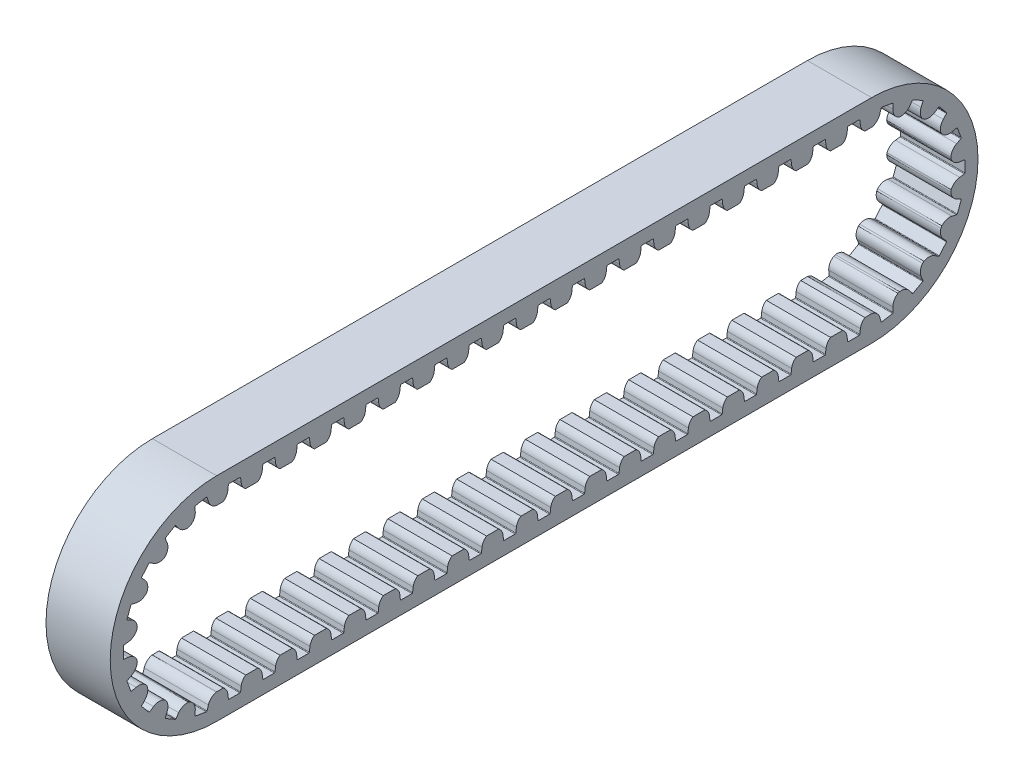
from build123d import *

# Parameters (mm, degrees)
SKETCH_2_W            = 15
SKETCH_2_H            = 6
CUT_EXTRUDE_1_DEPTH   = 180.728850361
PATTERN_START         = -7.5
PATTERN_CURVE_1_DEPTH = 15


# Read off the part's stored shape, not the designer's step: 曲线阵列1
with BuildPart() as part:
    # 扫描1: sweep along a path in 草图1
    with BuildLine(Plane(origin=(0, 0, 0), x_dir=(0, 0, -1), z_dir=(1, 0, 0))) as sweep_1_path:
        Line((0, 24.854), (152.99, 24.854))
        ThreePointArc((152.99, 24.854), (177.844, 0), (152.99, -24.854))
        Line((152.99, -24.854), (0, -24.854))
        ThreePointArc((0, -24.854), (-24.854, 0), (0, 24.854))
    # 草图2 → 扫描1 (sweep)
    with BuildSketch(Plane.XY):
        with Locations((0, 21.854)):
            Rectangle(SKETCH_2_W, SKETCH_2_H)
    sweep(path=sweep_1_path.line)

    # 草图3 → 切除-拉伸1 (cut, symmetric)
    with BuildSketch(Plane(origin=(0, 0, 0), x_dir=(0, 0, -1), z_dir=(1, 0, 0))):
        with BuildLine():
            Line((-21.804801654, 1.27369856), (-21.804801654, -1.27369856))
            ThreePointArc((-21.804801654, -1.27369856), (-21.766533045, -1.374706828), (-21.670941448, -1.425))
            Line((-21.670941448, -1.425), (-20.58500307, -1.558336467))
            ThreePointArc((-20.58500307, -1.558336467), (-19.042370581, -2.369954681), (-18.424801654, -4))
            Line((-18.424801654, -4), (-16.004407259, -4))
            Line((-16.004407259, -4), (-16.004407259, 4))
            Line((-16.004407259, 4), (-18.424801654, 4))
            ThreePointArc((-18.424801654, 4), (-19.042370581, 2.369954681), (-20.58500307, 1.558336467))
            Line((-20.58500307, 1.558336467), (-21.670941448, 1.425))
            ThreePointArc((-21.670941448, 1.425), (-21.766533045, 1.374706828), (-21.804801654, 1.27369856))
        make_face()
    extrude(amount=CUT_EXTRUDE_1_DEPTH, both=True, mode=Mode.SUBTRACT)

    # 曲线阵列1 outline → 曲线阵列1 (cut)
    with BuildSketch(Plane.YZ.offset(PATTERN_START)):
        with BuildLine():
            ThreePointArc((-8.533522732, 18.797599679), (-8.584391174, 17.497953181), (-9.29084833, 16.405896907))
            ThreePointArc((-9.29084833, 16.405896907), (-6.475461941, 17.707108987), (-3.484841437, 18.529144507))
            ThreePointArc((-3.484841437, 18.529144507), (-4.729140123, 18.907812434), (-5.606437375, 19.868030196))
            Line((-5.606437375, 19.868030196), (-6.10463171, 20.842116014))
            ThreePointArc((-6.10463171, 20.842116014), (-6.184696759, 20.914619424), (-6.292704149, 20.915868562))
            Line((-6.292704149, 20.915868562), (-8.685142806, 20.040957503))
            ThreePointArc((-8.685142806, 20.040957503), (-8.766863262, 19.97032519), (-8.781265879, 19.863275103))
            Line((-8.781265879, 19.863275103), (-8.533522732, 18.797599679))
        make_face()
        with BuildLine():
            ThreePointArc((-14.470518636, 14.723275938), (-14.071925319, 13.485216171), (-14.360338653, 12.216955012))
            ThreePointArc((-14.360338653, 12.216955012), (-12.163117675, 14.405966973), (-9.63674749, 16.205135415))
            ThreePointArc((-9.63674749, 16.205135415), (-10.93540996, 16.133410872), (-12.089130742, 16.733908146))
            Line((-12.089130742, 16.733908146), (-12.891572506, 17.477633895))
            ThreePointArc((-12.891572506, 17.477633895), (-12.991668699, 17.518228337), (-13.093535007, 17.482306033))
            Line((-13.093535007, 17.482306033), (-15.039950557, 15.838925799))
            ThreePointArc((-15.039950557, 15.838925799), (-15.092441072, 15.744522926), (-15.069200907, 15.639038086))
            Line((-15.069200907, 15.639038086), (-14.470518636, 14.723275938))
        make_face()
        with BuildLine():
            ThreePointArc((-18.647027875, 8.857715019), (-17.847465755, 7.831864623), (-17.682746835, 6.541695527))
            ThreePointArc((-17.682746835, 6.541695527), (-16.371005683, 9.352191665), (-14.616244601, 11.909605777))
            ThreePointArc((-14.616244601, 11.909605777), (-15.811275275, 11.396214789), (-17.101057649, 11.563934936))
            Line((-17.101057649, 11.563934936), (-18.110121591, 11.986818769))
            ThreePointArc((-18.110121591, 11.986818769), (-18.218071202, 11.990565514), (-18.301403349, 11.921842084))
            Line((-18.301403349, 11.921842084), (-19.564994423, 9.709926696))
            ThreePointArc((-19.564994423, 9.709926696), (-19.581868988, 9.603238338), (-19.523813446, 9.512152057))
            Line((-19.523813446, 9.512152057), (-18.647027875, 8.857715019))
        make_face()
        with BuildLine():
            ThreePointArc((-20.554935363, 1.91452243), (-19.451679354, 1.225686603), (-18.853867922, 0.070571842))
            ThreePointArc((-18.853867922, 0.070571842), (-18.587193329, 3.160626543), (-17.817525992, 6.165150729))
            ThreePointArc((-17.817525992, 6.165150729), (-18.763537162, 5.272552563), (-20.032465903, 4.987090711))
            Line((-20.032465903, 4.987090711), (-21.125389068, 5.037684483))
            ThreePointArc((-21.125389068, 5.037684483), (-21.228058922, 5.004127701), (-21.2827187, 4.910964053))
            Line((-21.2827187, 4.910964053), (-21.709756515, 2.399615651))
            ThreePointArc((-21.709756515, 2.399615651), (-21.688962167, 2.29362154), (-21.603154298, 2.228015395))
            Line((-21.603154298, 2.228015395), (-20.554935363, 1.91452243))
        make_face()
        with BuildLine():
            ThreePointArc((-20.58500307, -5.733417446), (-19.606011132, -6.073582752), (-18.854, -6.786756579))
            Line((-18.854, -6.786756579), (-18.854, -1.56340538))
            ThreePointArc((-18.854, -1.56340538), (-19.606011132, -2.276579207), (-20.58500307, -2.616744512))
            Line((-20.58500307, -2.616744512), (-21.670941448, -2.750080979))
            ThreePointArc((-21.670941448, -2.750080979), (-21.766533045, -2.800374151), (-21.804801654, -2.901382419))
            Line((-21.804801654, -2.901382419), (-21.804801654, -5.448779539))
            ThreePointArc((-21.804801654, -5.448779539), (-21.766533045, -5.549787807), (-21.670941448, -5.600080979))
            Line((-21.670941448, -5.600080979), (-20.58500307, -5.733417446))
        make_face()
        with BuildLine():
            ThreePointArc((-20.58500307, -13.768964004), (-19.606011132, -14.10912931), (-18.854, -14.822303137))
            Line((-18.854, -14.822303137), (-18.854, -9.598951938))
            ThreePointArc((-18.854, -9.598951938), (-19.606011132, -10.312125764), (-20.58500307, -10.65229107))
            Line((-20.58500307, -10.65229107), (-21.670941448, -10.785627537))
            ThreePointArc((-21.670941448, -10.785627537), (-21.766533045, -10.835920709), (-21.804801654, -10.936928977))
            Line((-21.804801654, -10.936928977), (-21.804801654, -13.484326097))
            ThreePointArc((-21.804801654, -13.484326097), (-21.766533045, -13.585334365), (-21.670941448, -13.635627537))
            Line((-21.670941448, -13.635627537), (-20.58500307, -13.768964004))
        make_face()
        with BuildLine():
            ThreePointArc((-20.58500307, -21.804510562), (-19.606011132, -22.144675868), (-18.854, -22.857849694))
            Line((-18.854, -22.857849694), (-18.854, -17.634498495))
            ThreePointArc((-18.854, -17.634498495), (-19.606011132, -18.347672322), (-20.58500307, -18.687837628))
            Line((-20.58500307, -18.687837628), (-21.670941448, -18.821174095))
            ThreePointArc((-21.670941448, -18.821174095), (-21.766533045, -18.871467267), (-21.804801654, -18.972475535))
            Line((-21.804801654, -18.972475535), (-21.804801654, -21.519872655))
            ThreePointArc((-21.804801654, -21.519872655), (-21.766533045, -21.620880923), (-21.670941448, -21.671174095))
            Line((-21.670941448, -21.671174095), (-20.58500307, -21.804510562))
        make_face()
        with BuildLine():
            ThreePointArc((-20.58500307, -29.84005712), (-19.606011132, -30.180222425), (-18.854, -30.893396252))
            Line((-18.854, -30.893396252), (-18.854, -25.670045053))
            ThreePointArc((-18.854, -25.670045053), (-19.606011132, -26.38321888), (-20.58500307, -26.723384186))
            Line((-20.58500307, -26.723384186), (-21.670941448, -26.856720653))
            ThreePointArc((-21.670941448, -26.856720653), (-21.766533045, -26.907013825), (-21.804801654, -27.008022093))
            Line((-21.804801654, -27.008022093), (-21.804801654, -29.555419213))
            ThreePointArc((-21.804801654, -29.555419213), (-21.766533045, -29.656427481), (-21.670941448, -29.706720653))
            Line((-21.670941448, -29.706720653), (-20.58500307, -29.84005712))
        make_face()
        with BuildLine():
            ThreePointArc((-20.58500307, -37.875603678), (-19.606011132, -38.215768983), (-18.854, -38.92894281))
            Line((-18.854, -38.92894281), (-18.854, -33.705591611))
            ThreePointArc((-18.854, -33.705591611), (-19.606011132, -34.418765438), (-20.58500307, -34.758930744))
            Line((-20.58500307, -34.758930744), (-21.670941448, -34.892267211))
            ThreePointArc((-21.670941448, -34.892267211), (-21.766533045, -34.942560383), (-21.804801654, -35.04356865))
            Line((-21.804801654, -35.04356865), (-21.804801654, -37.590965771))
            ThreePointArc((-21.804801654, -37.590965771), (-21.766533045, -37.691974039), (-21.670941448, -37.742267211))
            Line((-21.670941448, -37.742267211), (-20.58500307, -37.875603678))
        make_face()
        with BuildLine():
            ThreePointArc((-20.58500307, -45.911150235), (-19.606011132, -46.251315541), (-18.854, -46.964489368))
            Line((-18.854, -46.964489368), (-18.854, -41.741138169))
            ThreePointArc((-18.854, -41.741138169), (-19.606011132, -42.454311996), (-20.58500307, -42.794477302))
            Line((-20.58500307, -42.794477302), (-21.670941448, -42.927813769))
            ThreePointArc((-21.670941448, -42.927813769), (-21.766533045, -42.978106941), (-21.804801654, -43.079115208))
            Line((-21.804801654, -43.079115208), (-21.804801654, -45.626512329))
            ThreePointArc((-21.804801654, -45.626512329), (-21.766533045, -45.727520596), (-21.670941448, -45.777813769))
            Line((-21.670941448, -45.777813769), (-20.58500307, -45.911150235))
        make_face()
        with BuildLine():
            ThreePointArc((-20.58500307, -53.946696793), (-19.606011132, -54.286862099), (-18.854, -55.000035926))
            Line((-18.854, -55.000035926), (-18.854, -49.776684727))
            ThreePointArc((-18.854, -49.776684727), (-19.606011132, -50.489858554), (-20.58500307, -50.830023859))
            Line((-20.58500307, -50.830023859), (-21.670941448, -50.963360326))
            ThreePointArc((-21.670941448, -50.963360326), (-21.766533045, -51.013653499), (-21.804801654, -51.114661766))
            Line((-21.804801654, -51.114661766), (-21.804801654, -53.662058887))
            ThreePointArc((-21.804801654, -53.662058887), (-21.766533045, -53.763067154), (-21.670941448, -53.813360326))
            Line((-21.670941448, -53.813360326), (-20.58500307, -53.946696793))
        make_face()
        with BuildLine():
            ThreePointArc((-20.58500307, -61.982243351), (-19.606011132, -62.322408657), (-18.854, -63.035582484))
            Line((-18.854, -63.035582484), (-18.854, -57.812231285))
            ThreePointArc((-18.854, -57.812231285), (-19.606011132, -58.525405112), (-20.58500307, -58.865570417))
            Line((-20.58500307, -58.865570417), (-21.670941448, -58.998906884))
            ThreePointArc((-21.670941448, -58.998906884), (-21.766533045, -59.049200056), (-21.804801654, -59.150208324))
            Line((-21.804801654, -59.150208324), (-21.804801654, -61.697605444))
            ThreePointArc((-21.804801654, -61.697605444), (-21.766533045, -61.798613712), (-21.670941448, -61.848906884))
            Line((-21.670941448, -61.848906884), (-20.58500307, -61.982243351))
        make_face()
        with BuildLine():
            ThreePointArc((-20.58500307, -70.017789909), (-19.606011132, -70.357955215), (-18.854, -71.071129042))
            Line((-18.854, -71.071129042), (-18.854, -65.847777843))
            ThreePointArc((-18.854, -65.847777843), (-19.606011132, -66.560951669), (-20.58500307, -66.901116975))
            Line((-20.58500307, -66.901116975), (-21.670941448, -67.034453442))
            ThreePointArc((-21.670941448, -67.034453442), (-21.766533045, -67.084746614), (-21.804801654, -67.185754882))
            Line((-21.804801654, -67.185754882), (-21.804801654, -69.733152002))
            ThreePointArc((-21.804801654, -69.733152002), (-21.766533045, -69.83416027), (-21.670941448, -69.884453442))
            Line((-21.670941448, -69.884453442), (-20.58500307, -70.017789909))
        make_face()
        with BuildLine():
            ThreePointArc((-20.58500307, -78.053336467), (-19.606011132, -78.393501773), (-18.854, -79.1066756))
            Line((-18.854, -79.1066756), (-18.854, -73.8833244))
            ThreePointArc((-18.854, -73.8833244), (-19.606011132, -74.596498227), (-20.58500307, -74.936663533))
            Line((-20.58500307, -74.936663533), (-21.670941448, -75.07))
            ThreePointArc((-21.670941448, -75.07), (-21.766533045, -75.120293172), (-21.804801654, -75.22130144))
            Line((-21.804801654, -75.22130144), (-21.804801654, -77.76869856))
            ThreePointArc((-21.804801654, -77.76869856), (-21.766533045, -77.869706828), (-21.670941448, -77.92))
            Line((-21.670941448, -77.92), (-20.58500307, -78.053336467))
        make_face()
        with BuildLine():
            ThreePointArc((-20.58500307, -86.088883025), (-19.606011132, -86.429048331), (-18.854, -87.142222157))
            Line((-18.854, -87.142222157), (-18.854, -81.918870958))
            ThreePointArc((-18.854, -81.918870958), (-19.606011132, -82.632044785), (-20.58500307, -82.972210091))
            Line((-20.58500307, -82.972210091), (-21.670941448, -83.105546558))
            ThreePointArc((-21.670941448, -83.105546558), (-21.766533045, -83.15583973), (-21.804801654, -83.256847998))
            Line((-21.804801654, -83.256847998), (-21.804801654, -85.804245118))
            ThreePointArc((-21.804801654, -85.804245118), (-21.766533045, -85.905253386), (-21.670941448, -85.955546558))
            Line((-21.670941448, -85.955546558), (-20.58500307, -86.088883025))
        make_face()
        with BuildLine():
            ThreePointArc((-20.58500307, -94.124429583), (-19.606011132, -94.464594888), (-18.854, -95.177768715))
            Line((-18.854, -95.177768715), (-18.854, -89.954417516))
            ThreePointArc((-18.854, -89.954417516), (-19.606011132, -90.667591343), (-20.58500307, -91.007756649))
            Line((-20.58500307, -91.007756649), (-21.670941448, -91.141093116))
            ThreePointArc((-21.670941448, -91.141093116), (-21.766533045, -91.191386288), (-21.804801654, -91.292394556))
            Line((-21.804801654, -91.292394556), (-21.804801654, -93.839791676))
            ThreePointArc((-21.804801654, -93.839791676), (-21.766533045, -93.940799944), (-21.670941448, -93.991093116))
            Line((-21.670941448, -93.991093116), (-20.58500307, -94.124429583))
        make_face()
        with BuildLine():
            ThreePointArc((-20.58500307, -102.159976141), (-19.606011132, -102.500141446), (-18.854, -103.213315273))
            Line((-18.854, -103.213315273), (-18.854, -97.989964074))
            ThreePointArc((-18.854, -97.989964074), (-19.606011132, -98.703137901), (-20.58500307, -99.043303207))
            Line((-20.58500307, -99.043303207), (-21.670941448, -99.176639674))
            ThreePointArc((-21.670941448, -99.176639674), (-21.766533045, -99.226932846), (-21.804801654, -99.327941113))
            Line((-21.804801654, -99.327941113), (-21.804801654, -101.875338234))
            ThreePointArc((-21.804801654, -101.875338234), (-21.766533045, -101.976346501), (-21.670941448, -102.026639674))
            Line((-21.670941448, -102.026639674), (-20.58500307, -102.159976141))
        make_face()
        with BuildLine():
            ThreePointArc((-20.58500307, -110.195522698), (-19.606011132, -110.535688004), (-18.854, -111.248861831))
            Line((-18.854, -111.248861831), (-18.854, -106.025510632))
            ThreePointArc((-18.854, -106.025510632), (-19.606011132, -106.738684459), (-20.58500307, -107.078849765))
            Line((-20.58500307, -107.078849765), (-21.670941448, -107.212186231))
            ThreePointArc((-21.670941448, -107.212186231), (-21.766533045, -107.262479404), (-21.804801654, -107.363487671))
            Line((-21.804801654, -107.363487671), (-21.804801654, -109.910884792))
            ThreePointArc((-21.804801654, -109.910884792), (-21.766533045, -110.011893059), (-21.670941448, -110.062186231))
            Line((-21.670941448, -110.062186231), (-20.58500307, -110.195522698))
        make_face()
        with BuildLine():
            ThreePointArc((-20.58500307, -118.231069256), (-19.606011132, -118.571234562), (-18.854, -119.284408389))
            Line((-18.854, -119.284408389), (-18.854, -114.06105719))
            ThreePointArc((-18.854, -114.06105719), (-19.606011132, -114.774231017), (-20.58500307, -115.114396322))
            Line((-20.58500307, -115.114396322), (-21.670941448, -115.247732789))
            ThreePointArc((-21.670941448, -115.247732789), (-21.766533045, -115.298025961), (-21.804801654, -115.399034229))
            Line((-21.804801654, -115.399034229), (-21.804801654, -117.94643135))
            ThreePointArc((-21.804801654, -117.94643135), (-21.766533045, -118.047439617), (-21.670941448, -118.097732789))
            Line((-21.670941448, -118.097732789), (-20.58500307, -118.231069256))
        make_face()
        with BuildLine():
            ThreePointArc((-20.58500307, -126.266615814), (-19.606011132, -126.60678112), (-18.854, -127.319954947))
            Line((-18.854, -127.319954947), (-18.854, -122.096603748))
            ThreePointArc((-18.854, -122.096603748), (-19.606011132, -122.809777575), (-20.58500307, -123.14994288))
            Line((-20.58500307, -123.14994288), (-21.670941448, -123.283279347))
            ThreePointArc((-21.670941448, -123.283279347), (-21.766533045, -123.333572519), (-21.804801654, -123.434580787))
            Line((-21.804801654, -123.434580787), (-21.804801654, -125.981977907))
            ThreePointArc((-21.804801654, -125.981977907), (-21.766533045, -126.082986175), (-21.670941448, -126.133279347))
            Line((-21.670941448, -126.133279347), (-20.58500307, -126.266615814))
        make_face()
        with BuildLine():
            ThreePointArc((-20.58500307, -134.302162372), (-19.606011132, -134.642327678), (-18.854, -135.355501505))
            Line((-18.854, -135.355501505), (-18.854, -130.132150306))
            ThreePointArc((-18.854, -130.132150306), (-19.606011132, -130.845324132), (-20.58500307, -131.185489438))
            Line((-20.58500307, -131.185489438), (-21.670941448, -131.318825905))
            ThreePointArc((-21.670941448, -131.318825905), (-21.766533045, -131.369119077), (-21.804801654, -131.470127345))
            Line((-21.804801654, -131.470127345), (-21.804801654, -134.017524465))
            ThreePointArc((-21.804801654, -134.017524465), (-21.766533045, -134.118532733), (-21.670941448, -134.168825905))
            Line((-21.670941448, -134.168825905), (-20.58500307, -134.302162372))
        make_face()
        with BuildLine():
            ThreePointArc((-20.58500307, -142.33770893), (-19.606011132, -142.677874236), (-18.854, -143.391048062))
            Line((-18.854, -143.391048062), (-18.854, -138.167696863))
            ThreePointArc((-18.854, -138.167696863), (-19.606011132, -138.88087069), (-20.58500307, -139.221035996))
            Line((-20.58500307, -139.221035996), (-21.670941448, -139.354372463))
            ThreePointArc((-21.670941448, -139.354372463), (-21.766533045, -139.404665635), (-21.804801654, -139.505673903))
            Line((-21.804801654, -139.505673903), (-21.804801654, -142.053071023))
            ThreePointArc((-21.804801654, -142.053071023), (-21.766533045, -142.154079291), (-21.670941448, -142.204372463))
            Line((-21.670941448, -142.204372463), (-20.58500307, -142.33770893))
        make_face()
        with BuildLine():
            ThreePointArc((-20.58500307, -150.373255488), (-19.606011132, -150.713420794), (-18.854, -151.42659462))
            Line((-18.854, -151.42659462), (-18.854, -146.203243421))
            ThreePointArc((-18.854, -146.203243421), (-19.606011132, -146.916417248), (-20.58500307, -147.256582554))
            Line((-20.58500307, -147.256582554), (-21.670941448, -147.389919021))
            ThreePointArc((-21.670941448, -147.389919021), (-21.766533045, -147.440212193), (-21.804801654, -147.541220461))
            Line((-21.804801654, -147.541220461), (-21.804801654, -150.088617581))
            ThreePointArc((-21.804801654, -150.088617581), (-21.766533045, -150.189625849), (-21.670941448, -150.239919021))
            Line((-21.670941448, -150.239919021), (-20.58500307, -150.373255488))
        make_face()
        with BuildLine():
            ThreePointArc((-20.032465903, -157.977090711), (-18.763537162, -158.262552563), (-17.817525992, -159.155150729))
            ThreePointArc((-17.817525992, -159.155150729), (-18.587193329, -156.150626543), (-18.853867922, -153.060571842))
            ThreePointArc((-18.853867922, -153.060571842), (-19.451679354, -154.215686603), (-20.554935363, -154.90452243))
            Line((-20.554935363, -154.90452243), (-21.603154298, -155.218015395))
            ThreePointArc((-21.603154298, -155.218015395), (-21.688962167, -155.28362154), (-21.709756515, -155.389615651))
            Line((-21.709756515, -155.389615651), (-21.2827187, -157.900964053))
            ThreePointArc((-21.2827187, -157.900964053), (-21.228058922, -157.994127701), (-21.125389068, -158.027684483))
            Line((-21.125389068, -158.027684483), (-20.032465903, -157.977090711))
        make_face()
        with BuildLine():
            ThreePointArc((-17.101057649, -164.553934936), (-15.811275275, -164.386214789), (-14.616244601, -164.899605777))
            ThreePointArc((-14.616244601, -164.899605777), (-16.371005683, -162.342191665), (-17.682746835, -159.531695527))
            ThreePointArc((-17.682746835, -159.531695527), (-17.847465755, -160.821864623), (-18.647027875, -161.847715019))
            Line((-18.647027875, -161.847715019), (-19.523813446, -162.502152057))
            ThreePointArc((-19.523813446, -162.502152057), (-19.581868988, -162.593238338), (-19.564994423, -162.699926696))
            Line((-19.564994423, -162.699926696), (-18.301403349, -164.911842084))
            ThreePointArc((-18.301403349, -164.911842084), (-18.218071202, -164.980565514), (-18.110121591, -164.976818769))
            Line((-18.110121591, -164.976818769), (-17.101057649, -164.553934936))
        make_face()
        with BuildLine():
            ThreePointArc((-12.089130742, -169.723908146), (-10.93540996, -169.123410872), (-9.63674749, -169.195135415))
            ThreePointArc((-9.63674749, -169.195135415), (-12.163117675, -167.395966973), (-14.360338653, -165.206955012))
            ThreePointArc((-14.360338653, -165.206955012), (-14.071925319, -166.475216171), (-14.470518636, -167.713275938))
            Line((-14.470518636, -167.713275938), (-15.069200907, -168.629038086))
            ThreePointArc((-15.069200907, -168.629038086), (-15.092441072, -168.734522926), (-15.039950557, -168.828925799))
            Line((-15.039950557, -168.828925799), (-13.093535007, -170.472306033))
            ThreePointArc((-13.093535007, -170.472306033), (-12.991668699, -170.508228337), (-12.891572506, -170.467633895))
            Line((-12.891572506, -170.467633895), (-12.089130742, -169.723908146))
        make_face()
        with BuildLine():
            ThreePointArc((-5.606437375, -172.858030196), (-4.729140123, -171.897812434), (-3.484841437, -171.519144507))
            ThreePointArc((-3.484841437, -171.519144507), (-6.475461941, -170.697108986), (-9.29084833, -169.395896907))
            ThreePointArc((-9.29084833, -169.395896907), (-8.584391174, -170.487953181), (-8.533522732, -171.787599679))
            Line((-8.533522732, -171.787599679), (-8.781265879, -172.853275103))
            ThreePointArc((-8.781265879, -172.853275103), (-8.766863262, -172.96032519), (-8.685142806, -173.030957503))
            Line((-8.685142806, -173.030957503), (-6.292704149, -173.905868562))
            ThreePointArc((-6.292704149, -173.905868562), (-6.184696759, -173.904619424), (-6.10463171, -173.832116014))
            Line((-6.10463171, -173.832116014), (-5.606437375, -172.858030196))
        make_face()
        with BuildLine():
            ThreePointArc((1.558336467, -173.57500307), (2.052478001, -172.371885136), (3.091031236, -171.588893567))
            ThreePointArc((3.091031236, -171.588893567), (0, -171.844), (-3.091031236, -171.588893567))
            ThreePointArc((-3.091031236, -171.588893567), (-2.052478001, -172.371885136), (-1.558336467, -173.57500307))
            Line((-1.558336467, -173.57500307), (-1.425, -174.660941448))
            ThreePointArc((-1.425, -174.660941448), (-1.374706828, -174.756533045), (-1.27369856, -174.794801654))
            Line((-1.27369856, -174.794801654), (1.27369856, -174.794801654))
            ThreePointArc((1.27369856, -174.794801654), (1.374706828, -174.756533045), (1.425, -174.660941448))
            Line((1.425, -174.660941448), (1.558336467, -173.57500307))
        make_face()
        with BuildLine():
            ThreePointArc((8.533522732, -171.787599679), (8.584391174, -170.487953181), (9.29084833, -169.395896907))
            ThreePointArc((9.29084833, -169.395896907), (6.475461941, -170.697108986), (3.484841437, -171.519144507))
            ThreePointArc((3.484841437, -171.519144507), (4.729140123, -171.897812434), (5.606437375, -172.858030196))
            Line((5.606437375, -172.858030196), (6.10463171, -173.832116014))
            ThreePointArc((6.10463171, -173.832116014), (6.184696759, -173.904619424), (6.292704149, -173.905868562))
            Line((6.292704149, -173.905868562), (8.685142806, -173.030957503))
            ThreePointArc((8.685142806, -173.030957503), (8.766863262, -172.96032519), (8.781265879, -172.853275103))
            Line((8.781265879, -172.853275103), (8.533522732, -171.787599679))
        make_face()
        with BuildLine():
            ThreePointArc((14.470518636, -167.713275938), (14.071925319, -166.475216171), (14.360338653, -165.206955012))
            ThreePointArc((14.360338653, -165.206955012), (12.163117675, -167.395966973), (9.63674749, -169.195135415))
            ThreePointArc((9.63674749, -169.195135415), (10.93540996, -169.123410872), (12.089130742, -169.723908146))
            Line((12.089130742, -169.723908146), (12.891572506, -170.467633895))
            ThreePointArc((12.891572506, -170.467633895), (12.991668699, -170.508228337), (13.093535007, -170.472306033))
            Line((13.093535007, -170.472306033), (15.039950557, -168.828925799))
            ThreePointArc((15.039950557, -168.828925799), (15.092441072, -168.734522926), (15.069200907, -168.629038086))
            Line((15.069200907, -168.629038086), (14.470518636, -167.713275938))
        make_face()
        with BuildLine():
            ThreePointArc((18.647027875, -161.847715019), (17.847465755, -160.821864623), (17.682746835, -159.531695527))
            ThreePointArc((17.682746835, -159.531695527), (16.371005683, -162.342191665), (14.616244601, -164.899605777))
            ThreePointArc((14.616244601, -164.899605777), (15.811275275, -164.386214789), (17.101057649, -164.553934936))
            Line((17.101057649, -164.553934936), (18.110121591, -164.976818769))
            ThreePointArc((18.110121591, -164.976818769), (18.218071202, -164.980565514), (18.301403349, -164.911842084))
            Line((18.301403349, -164.911842084), (19.564994423, -162.699926696))
            ThreePointArc((19.564994423, -162.699926696), (19.581868988, -162.593238338), (19.523813446, -162.502152057))
            Line((19.523813446, -162.502152057), (18.647027875, -161.847715019))
        make_face()
        with BuildLine():
            ThreePointArc((20.554935363, -154.90452243), (19.451679354, -154.215686603), (18.853867922, -153.060571842))
            ThreePointArc((18.853867922, -153.060571842), (18.587193329, -156.150626543), (17.817525992, -159.155150729))
            ThreePointArc((17.817525992, -159.155150729), (18.763537162, -158.262552563), (20.032465903, -157.977090711))
            Line((20.032465903, -157.977090711), (21.125389068, -158.027684483))
            ThreePointArc((21.125389068, -158.027684483), (21.228058922, -157.994127701), (21.2827187, -157.900964053))
            Line((21.2827187, -157.900964053), (21.709756515, -155.389615651))
            ThreePointArc((21.709756515, -155.389615651), (21.688962167, -155.28362154), (21.603154298, -155.218015395))
            Line((21.603154298, -155.218015395), (20.554935363, -154.90452243))
        make_face()
        with BuildLine():
            ThreePointArc((20.58500307, -147.256582554), (19.606011132, -146.916417248), (18.854, -146.203243421))
            Line((18.854, -146.203243421), (18.854, -151.42659462))
            ThreePointArc((18.854, -151.42659462), (19.606011132, -150.713420794), (20.58500307, -150.373255488))
            Line((20.58500307, -150.373255488), (21.670941448, -150.239919021))
            ThreePointArc((21.670941448, -150.239919021), (21.766533045, -150.189625849), (21.804801654, -150.088617581))
            Line((21.804801654, -150.088617581), (21.804801654, -147.541220461))
            ThreePointArc((21.804801654, -147.541220461), (21.766533045, -147.440212193), (21.670941448, -147.389919021))
            Line((21.670941448, -147.389919021), (20.58500307, -147.256582554))
        make_face()
        with BuildLine():
            ThreePointArc((20.58500307, -139.221035996), (19.606011132, -138.88087069), (18.854, -138.167696863))
            Line((18.854, -138.167696863), (18.854, -143.391048062))
            ThreePointArc((18.854, -143.391048062), (19.606011132, -142.677874236), (20.58500307, -142.33770893))
            Line((20.58500307, -142.33770893), (21.670941448, -142.204372463))
            ThreePointArc((21.670941448, -142.204372463), (21.766533045, -142.154079291), (21.804801654, -142.053071023))
            Line((21.804801654, -142.053071023), (21.804801654, -139.505673903))
            ThreePointArc((21.804801654, -139.505673903), (21.766533045, -139.404665635), (21.670941448, -139.354372463))
            Line((21.670941448, -139.354372463), (20.58500307, -139.221035996))
        make_face()
        with BuildLine():
            ThreePointArc((20.58500307, -131.185489438), (19.606011132, -130.845324132), (18.854, -130.132150306))
            Line((18.854, -130.132150306), (18.854, -135.355501505))
            ThreePointArc((18.854, -135.355501505), (19.606011132, -134.642327678), (20.58500307, -134.302162372))
            Line((20.58500307, -134.302162372), (21.670941448, -134.168825905))
            ThreePointArc((21.670941448, -134.168825905), (21.766533045, -134.118532733), (21.804801654, -134.017524465))
            Line((21.804801654, -134.017524465), (21.804801654, -131.470127345))
            ThreePointArc((21.804801654, -131.470127345), (21.766533045, -131.369119077), (21.670941448, -131.318825905))
            Line((21.670941448, -131.318825905), (20.58500307, -131.185489438))
        make_face()
        with BuildLine():
            ThreePointArc((20.58500307, -123.14994288), (19.606011132, -122.809777575), (18.854, -122.096603748))
            Line((18.854, -122.096603748), (18.854, -127.319954947))
            ThreePointArc((18.854, -127.319954947), (19.606011132, -126.60678112), (20.58500307, -126.266615814))
            Line((20.58500307, -126.266615814), (21.670941448, -126.133279347))
            ThreePointArc((21.670941448, -126.133279347), (21.766533045, -126.082986175), (21.804801654, -125.981977907))
            Line((21.804801654, -125.981977907), (21.804801654, -123.434580787))
            ThreePointArc((21.804801654, -123.434580787), (21.766533045, -123.333572519), (21.670941448, -123.283279347))
            Line((21.670941448, -123.283279347), (20.58500307, -123.14994288))
        make_face()
        with BuildLine():
            ThreePointArc((20.58500307, -115.114396322), (19.606011132, -114.774231017), (18.854, -114.06105719))
            Line((18.854, -114.06105719), (18.854, -119.284408389))
            ThreePointArc((18.854, -119.284408389), (19.606011132, -118.571234562), (20.58500307, -118.231069256))
            Line((20.58500307, -118.231069256), (21.670941448, -118.097732789))
            ThreePointArc((21.670941448, -118.097732789), (21.766533045, -118.047439617), (21.804801654, -117.94643135))
            Line((21.804801654, -117.94643135), (21.804801654, -115.399034229))
            ThreePointArc((21.804801654, -115.399034229), (21.766533045, -115.298025961), (21.670941448, -115.247732789))
            Line((21.670941448, -115.247732789), (20.58500307, -115.114396322))
        make_face()
        with BuildLine():
            ThreePointArc((20.58500307, -107.078849765), (19.606011132, -106.738684459), (18.854, -106.025510632))
            Line((18.854, -106.025510632), (18.854, -111.248861831))
            ThreePointArc((18.854, -111.248861831), (19.606011132, -110.535688004), (20.58500307, -110.195522698))
            Line((20.58500307, -110.195522698), (21.670941448, -110.062186231))
            ThreePointArc((21.670941448, -110.062186231), (21.766533045, -110.011893059), (21.804801654, -109.910884792))
            Line((21.804801654, -109.910884792), (21.804801654, -107.363487671))
            ThreePointArc((21.804801654, -107.363487671), (21.766533045, -107.262479404), (21.670941448, -107.212186231))
            Line((21.670941448, -107.212186231), (20.58500307, -107.078849765))
        make_face()
        with BuildLine():
            ThreePointArc((20.58500307, -99.043303207), (19.606011132, -98.703137901), (18.854, -97.989964074))
            Line((18.854, -97.989964074), (18.854, -103.213315273))
            ThreePointArc((18.854, -103.213315273), (19.606011132, -102.500141446), (20.58500307, -102.159976141))
            Line((20.58500307, -102.159976141), (21.670941448, -102.026639674))
            ThreePointArc((21.670941448, -102.026639674), (21.766533045, -101.976346501), (21.804801654, -101.875338234))
            Line((21.804801654, -101.875338234), (21.804801654, -99.327941113))
            ThreePointArc((21.804801654, -99.327941113), (21.766533045, -99.226932846), (21.670941448, -99.176639674))
            Line((21.670941448, -99.176639674), (20.58500307, -99.043303207))
        make_face()
        with BuildLine():
            ThreePointArc((20.58500307, -91.007756649), (19.606011132, -90.667591343), (18.854, -89.954417516))
            Line((18.854, -89.954417516), (18.854, -95.177768715))
            ThreePointArc((18.854, -95.177768715), (19.606011132, -94.464594888), (20.58500307, -94.124429583))
            Line((20.58500307, -94.124429583), (21.670941448, -93.991093116))
            ThreePointArc((21.670941448, -93.991093116), (21.766533045, -93.940799944), (21.804801654, -93.839791676))
            Line((21.804801654, -93.839791676), (21.804801654, -91.292394556))
            ThreePointArc((21.804801654, -91.292394556), (21.766533045, -91.191386288), (21.670941448, -91.141093116))
            Line((21.670941448, -91.141093116), (20.58500307, -91.007756649))
        make_face()
        with BuildLine():
            ThreePointArc((20.58500307, -82.972210091), (19.606011132, -82.632044785), (18.854, -81.918870958))
            Line((18.854, -81.918870958), (18.854, -87.142222157))
            ThreePointArc((18.854, -87.142222157), (19.606011132, -86.429048331), (20.58500307, -86.088883025))
            Line((20.58500307, -86.088883025), (21.670941448, -85.955546558))
            ThreePointArc((21.670941448, -85.955546558), (21.766533045, -85.905253386), (21.804801654, -85.804245118))
            Line((21.804801654, -85.804245118), (21.804801654, -83.256847998))
            ThreePointArc((21.804801654, -83.256847998), (21.766533045, -83.15583973), (21.670941448, -83.105546558))
            Line((21.670941448, -83.105546558), (20.58500307, -82.972210091))
        make_face()
        with BuildLine():
            ThreePointArc((20.58500307, -74.936663533), (19.606011132, -74.596498227), (18.854, -73.8833244))
            Line((18.854, -73.8833244), (18.854, -79.1066756))
            ThreePointArc((18.854, -79.1066756), (19.606011132, -78.393501773), (20.58500307, -78.053336467))
            Line((20.58500307, -78.053336467), (21.670941448, -77.92))
            ThreePointArc((21.670941448, -77.92), (21.766533045, -77.869706828), (21.804801654, -77.76869856))
            Line((21.804801654, -77.76869856), (21.804801654, -75.22130144))
            ThreePointArc((21.804801654, -75.22130144), (21.766533045, -75.120293172), (21.670941448, -75.07))
            Line((21.670941448, -75.07), (20.58500307, -74.936663533))
        make_face()
        with BuildLine():
            ThreePointArc((20.58500307, -66.901116975), (19.606011132, -66.560951669), (18.854, -65.847777843))
            Line((18.854, -65.847777843), (18.854, -71.071129042))
            ThreePointArc((18.854, -71.071129042), (19.606011132, -70.357955215), (20.58500307, -70.017789909))
            Line((20.58500307, -70.017789909), (21.670941448, -69.884453442))
            ThreePointArc((21.670941448, -69.884453442), (21.766533045, -69.83416027), (21.804801654, -69.733152002))
            Line((21.804801654, -69.733152002), (21.804801654, -67.185754882))
            ThreePointArc((21.804801654, -67.185754882), (21.766533045, -67.084746614), (21.670941448, -67.034453442))
            Line((21.670941448, -67.034453442), (20.58500307, -66.901116975))
        make_face()
        with BuildLine():
            ThreePointArc((20.58500307, -58.865570417), (19.606011132, -58.525405112), (18.854, -57.812231285))
            Line((18.854, -57.812231285), (18.854, -63.035582484))
            ThreePointArc((18.854, -63.035582484), (19.606011132, -62.322408657), (20.58500307, -61.982243351))
            Line((20.58500307, -61.982243351), (21.670941448, -61.848906884))
            ThreePointArc((21.670941448, -61.848906884), (21.766533045, -61.798613712), (21.804801654, -61.697605444))
            Line((21.804801654, -61.697605444), (21.804801654, -59.150208324))
            ThreePointArc((21.804801654, -59.150208324), (21.766533045, -59.049200056), (21.670941448, -58.998906884))
            Line((21.670941448, -58.998906884), (20.58500307, -58.865570417))
        make_face()
        with BuildLine():
            ThreePointArc((20.58500307, -50.830023859), (19.606011132, -50.489858554), (18.854, -49.776684727))
            Line((18.854, -49.776684727), (18.854, -55.000035926))
            ThreePointArc((18.854, -55.000035926), (19.606011132, -54.286862099), (20.58500307, -53.946696793))
            Line((20.58500307, -53.946696793), (21.670941448, -53.813360326))
            ThreePointArc((21.670941448, -53.813360326), (21.766533045, -53.763067154), (21.804801654, -53.662058887))
            Line((21.804801654, -53.662058887), (21.804801654, -51.114661766))
            ThreePointArc((21.804801654, -51.114661766), (21.766533045, -51.013653499), (21.670941448, -50.963360326))
            Line((21.670941448, -50.963360326), (20.58500307, -50.830023859))
        make_face()
        with BuildLine():
            ThreePointArc((20.58500307, -42.794477302), (19.606011132, -42.454311996), (18.854, -41.741138169))
            Line((18.854, -41.741138169), (18.854, -46.964489368))
            ThreePointArc((18.854, -46.964489368), (19.606011132, -46.251315541), (20.58500307, -45.911150235))
            Line((20.58500307, -45.911150235), (21.670941448, -45.777813769))
            ThreePointArc((21.670941448, -45.777813769), (21.766533045, -45.727520596), (21.804801654, -45.626512329))
            Line((21.804801654, -45.626512329), (21.804801654, -43.079115208))
            ThreePointArc((21.804801654, -43.079115208), (21.766533045, -42.978106941), (21.670941448, -42.927813769))
            Line((21.670941448, -42.927813769), (20.58500307, -42.794477302))
        make_face()
        with BuildLine():
            ThreePointArc((20.58500307, -34.758930744), (19.606011132, -34.418765438), (18.854, -33.705591611))
            Line((18.854, -33.705591611), (18.854, -38.92894281))
            ThreePointArc((18.854, -38.92894281), (19.606011132, -38.215768983), (20.58500307, -37.875603678))
            Line((20.58500307, -37.875603678), (21.670941448, -37.742267211))
            ThreePointArc((21.670941448, -37.742267211), (21.766533045, -37.691974039), (21.804801654, -37.590965771))
            Line((21.804801654, -37.590965771), (21.804801654, -35.04356865))
            ThreePointArc((21.804801654, -35.04356865), (21.766533045, -34.942560383), (21.670941448, -34.892267211))
            Line((21.670941448, -34.892267211), (20.58500307, -34.758930744))
        make_face()
        with BuildLine():
            ThreePointArc((20.58500307, -26.723384186), (19.606011132, -26.38321888), (18.854, -25.670045053))
            Line((18.854, -25.670045053), (18.854, -30.893396252))
            ThreePointArc((18.854, -30.893396252), (19.606011132, -30.180222425), (20.58500307, -29.84005712))
            Line((20.58500307, -29.84005712), (21.670941448, -29.706720653))
            ThreePointArc((21.670941448, -29.706720653), (21.766533045, -29.656427481), (21.804801654, -29.555419213))
            Line((21.804801654, -29.555419213), (21.804801654, -27.008022093))
            ThreePointArc((21.804801654, -27.008022093), (21.766533045, -26.907013825), (21.670941448, -26.856720653))
            Line((21.670941448, -26.856720653), (20.58500307, -26.723384186))
        make_face()
        with BuildLine():
            ThreePointArc((20.58500307, -18.687837628), (19.606011132, -18.347672322), (18.854, -17.634498495))
            Line((18.854, -17.634498495), (18.854, -22.857849694))
            ThreePointArc((18.854, -22.857849694), (19.606011132, -22.144675868), (20.58500307, -21.804510562))
            Line((20.58500307, -21.804510562), (21.670941448, -21.671174095))
            ThreePointArc((21.670941448, -21.671174095), (21.766533045, -21.620880923), (21.804801654, -21.519872655))
            Line((21.804801654, -21.519872655), (21.804801654, -18.972475535))
            ThreePointArc((21.804801654, -18.972475535), (21.766533045, -18.871467267), (21.670941448, -18.821174095))
            Line((21.670941448, -18.821174095), (20.58500307, -18.687837628))
        make_face()
        with BuildLine():
            ThreePointArc((20.58500307, -10.65229107), (19.606011132, -10.312125764), (18.854, -9.598951938))
            Line((18.854, -9.598951938), (18.854, -14.822303137))
            ThreePointArc((18.854, -14.822303137), (19.606011132, -14.10912931), (20.58500307, -13.768964004))
            Line((20.58500307, -13.768964004), (21.670941448, -13.635627537))
            ThreePointArc((21.670941448, -13.635627537), (21.766533045, -13.585334365), (21.804801654, -13.484326097))
            Line((21.804801654, -13.484326097), (21.804801654, -10.936928977))
            ThreePointArc((21.804801654, -10.936928977), (21.766533045, -10.835920709), (21.670941448, -10.785627537))
            Line((21.670941448, -10.785627537), (20.58500307, -10.65229107))
        make_face()
        with BuildLine():
            ThreePointArc((3.484841437, 18.529144507), (6.475461941, 17.707108987), (9.29084833, 16.405896907))
            ThreePointArc((9.29084833, 16.405896907), (8.584391174, 17.497953181), (8.533522732, 18.797599679))
            Line((8.533522732, 18.797599679), (8.781265879, 19.863275103))
            ThreePointArc((8.781265879, 19.863275103), (8.766863262, 19.97032519), (8.685142806, 20.040957503))
            Line((8.685142806, 20.040957503), (6.292704149, 20.915868562))
            ThreePointArc((6.292704149, 20.915868562), (6.184696759, 20.914619424), (6.10463171, 20.842116014))
            Line((6.10463171, 20.842116014), (5.606437375, 19.868030196))
            ThreePointArc((5.606437375, 19.868030196), (4.729140123, 18.907812434), (3.484841437, 18.529144507))
        make_face()
        with BuildLine():
            ThreePointArc((9.63674749, 16.205135415), (12.163117675, 14.405966973), (14.360338653, 12.216955012))
            ThreePointArc((14.360338653, 12.216955012), (14.071925319, 13.485216171), (14.470518636, 14.723275938))
            Line((14.470518636, 14.723275938), (15.069200907, 15.639038086))
            ThreePointArc((15.069200907, 15.639038086), (15.092441072, 15.744522926), (15.039950557, 15.838925799))
            Line((15.039950557, 15.838925799), (13.093535007, 17.482306033))
            ThreePointArc((13.093535007, 17.482306033), (12.991668699, 17.518228337), (12.891572506, 17.477633895))
            Line((12.891572506, 17.477633895), (12.089130742, 16.733908146))
            ThreePointArc((12.089130742, 16.733908146), (10.93540996, 16.133410872), (9.63674749, 16.205135415))
        make_face()
        with BuildLine():
            ThreePointArc((14.616244601, 11.909605777), (16.371005683, 9.352191665), (17.682746835, 6.541695527))
            ThreePointArc((17.682746835, 6.541695527), (17.847465755, 7.831864623), (18.647027875, 8.857715019))
            Line((18.647027875, 8.857715019), (19.523813446, 9.512152057))
            ThreePointArc((19.523813446, 9.512152057), (19.581868988, 9.603238338), (19.564994423, 9.709926696))
            Line((19.564994423, 9.709926696), (18.301403349, 11.921842084))
            ThreePointArc((18.301403349, 11.921842084), (18.218071202, 11.990565514), (18.110121591, 11.986818769))
            Line((18.110121591, 11.986818769), (17.101057649, 11.563934936))
            ThreePointArc((17.101057649, 11.563934936), (15.811275275, 11.396214789), (14.616244601, 11.909605777))
        make_face()
        with BuildLine():
            ThreePointArc((17.817525992, 6.165150729), (18.587193329, 3.160626543), (18.853867922, 0.070571842))
            ThreePointArc((18.853867922, 0.070571842), (19.451679354, 1.225686603), (20.554935363, 1.91452243))
            Line((20.554935363, 1.91452243), (21.603154298, 2.228015395))
            ThreePointArc((21.603154298, 2.228015395), (21.688962167, 2.29362154), (21.709756515, 2.399615651))
            Line((21.709756515, 2.399615651), (21.2827187, 4.910964053))
            ThreePointArc((21.2827187, 4.910964053), (21.228058922, 5.004127701), (21.125389068, 5.037684483))
            Line((21.125389068, 5.037684483), (20.032465903, 4.987090711))
            ThreePointArc((20.032465903, 4.987090711), (18.763537162, 5.272552563), (17.817525992, 6.165150729))
        make_face()
        with BuildLine():
            ThreePointArc((18.854, -6.786756579), (19.606011132, -6.073582752), (20.58500307, -5.733417446))
            Line((20.58500307, -5.733417446), (21.670941448, -5.600080979))
            ThreePointArc((21.670941448, -5.600080979), (21.766533045, -5.549787807), (21.804801654, -5.448779539))
            Line((21.804801654, -5.448779539), (21.804801654, -2.901382419))
            ThreePointArc((21.804801654, -2.901382419), (21.766533045, -2.800374151), (21.670941448, -2.750080979))
            Line((21.670941448, -2.750080979), (20.58500307, -2.616744512))
            ThreePointArc((20.58500307, -2.616744512), (19.606011132, -2.276579207), (18.854, -1.56340538))
            Line((18.854, -1.56340538), (18.854, -6.786756579))
        make_face()
    extrude(amount=PATTERN_CURVE_1_DEPTH, mode=Mode.SUBTRACT)


solid = part.part
